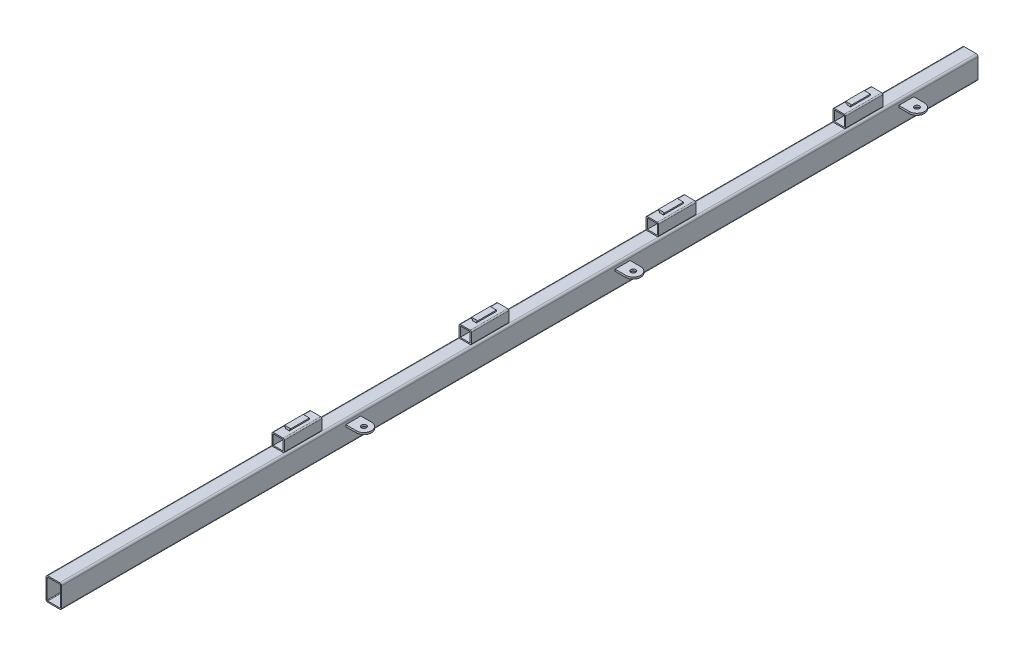
from build123d import *

# Parameters (mm, degrees)
EXTRUDE_THIN1_DEPTH = 1470
SKETCH2_R           = 4
BOSS_EXTRUDE1_DEPTH = 3
SKETCH3_W           = 16
SKETCH3_H           = 16
EXTRUDE_THIN2_DEPTH = 60
BOSS_EXTRUDE2_DEPTH = 15
LPATTERN1_COUNT     = 4
LPATTERN1_PITCH     = 300


with BuildPart() as part:
    # Sketch1 → Extrude-Thin1 (new body)
    with BuildSketch(Plane.XY):
        with BuildLine():
            Line((-9.5, 37), (9.5, 37))
            ThreePointArc((9.5, 37), (11.621320344, 36.121320344), (12.5, 34))
            Line((12.5, 34), (12.5, 3))
            ThreePointArc((12.5, 3), (11.621320344, 0.878679656), (9.5, 0))
            Line((9.5, 0), (-9.5, 0))
            ThreePointArc((-9.5, 0), (-11.621320344, 0.878679656), (-12.5, 3))
            Line((-12.5, 3), (-12.5, 34))
            ThreePointArc((-12.5, 34), (-11.621320344, 36.121320344), (-9.5, 37))
        make_face()
        with BuildLine():
            Line((-9.5, 35), (9.5, 35))
            ThreePointArc((9.5, 35), (10.207106781, 34.707106781), (10.5, 34))
            Line((10.5, 34), (10.5, 3))
            ThreePointArc((10.5, 3), (10.207106781, 2.292893219), (9.5, 2))
            Line((9.5, 2), (-9.5, 2))
            ThreePointArc((-9.5, 2), (-10.207106781, 2.292893219), (-10.5, 3))
            Line((-10.5, 3), (-10.5, 34))
            ThreePointArc((-10.5, 34), (-10.207106781, 34.707106781), (-9.5, 35))
        make_face(mode=Mode.SUBTRACT)
    extrude(amount=EXTRUDE_THIN1_DEPTH)

    # Sketch2 → Boss-Extrude1 (add)
    # profile 1 of 3: a face of its own
    with BuildSketch(Plane(origin=(0, 27, 0), x_dir=(1, 0, 0), z_dir=(0, 1, 0))):
        with BuildLine():
            Line((29.5, -103), (12.5, -103))
            Line((12.5, -103), (12.5, -127))
            Line((12.5, -127), (29.5, -127))
            ThreePointArc((29.5, -127), (41.5, -115), (29.5, -103))
        make_face()
        with Locations((29.5, -115)):
            Circle(SKETCH2_R, mode=Mode.SUBTRACT)
    # profile 2 of 3: a face of its own
    with BuildSketch(Plane(origin=(0, 27, 0), x_dir=(1, 0, 0), z_dir=(0, 1, 0))):
        with BuildLine():
            Line((29.5, -558), (12.5, -558))
            Line((12.5, -558), (12.5, -582))
            Line((12.5, -582), (29.5, -582))
            ThreePointArc((29.5, -582), (41.5, -570), (29.5, -558))
        make_face()
        with Locations((29.5, -570)):
            Circle(SKETCH2_R, mode=Mode.SUBTRACT)
    # profile 3 of 3: a face of its own
    with BuildSketch(Plane(origin=(0, 27, 0), x_dir=(1, 0, 0), z_dir=(0, 1, 0))):
        with BuildLine():
            Line((29.5, -990), (12.5, -990))
            Line((12.5, -990), (12.5, -1014))
            Line((12.5, -1014), (29.5, -1014))
            ThreePointArc((29.5, -1014), (41.5, -1002), (29.5, -990))
        make_face()
        with Locations((29.5, -1002)):
            Circle(SKETCH2_R, mode=Mode.SUBTRACT)
    extrude(amount=BOSS_EXTRUDE1_DEPTH)

    # Sketch3 → Extrude-Thin2 (add)
    with BuildSketch(Plane(origin=(0, 0, 150), x_dir=(-1, 0, 0), z_dir=(0, 0, -1))):
        with BuildLine():
            Line((10, 55), (10, 39))
            ThreePointArc((10, 39), (9.414213562, 37.585786438), (8, 37))
            Line((8, 37), (-8, 37))
            ThreePointArc((-8, 37), (-9.414213562, 37.585786438), (-10, 39))
            Line((-10, 39), (-10, 55))
            ThreePointArc((-10, 55), (-9.414213562, 56.414213562), (-8, 57))
            Line((-8, 57), (8, 57))
            ThreePointArc((8, 57), (9.414213562, 56.414213562), (10, 55))
        make_face()
        with Locations((0, 47)):
            Rectangle(SKETCH3_W, SKETCH3_H, mode=Mode.SUBTRACT)
    extrude_thin2 = extrude(amount=-EXTRUDE_THIN2_DEPTH)

    # Sketch4 → Boss-Extrude2 (add, symmetric)
    with BuildSketch(Plane.XY.offset(180)):
        Polygon((-3, 57), (-3, 59), (-5, 59), (-5, 61), (5, 61), (5, 59), (3, 59), (3, 57), align=None)
    boss_extrude2 = extrude(amount=BOSS_EXTRUDE2_DEPTH, both=True)

    # LPattern1: Extrude-Thin2, Boss-Extrude2 ×4
    with Locations(*[(0, 0, i * LPATTERN1_PITCH) for i in range(1, LPATTERN1_COUNT)]):
        add(extrude_thin2)
        add(boss_extrude2)


solid = part.part
